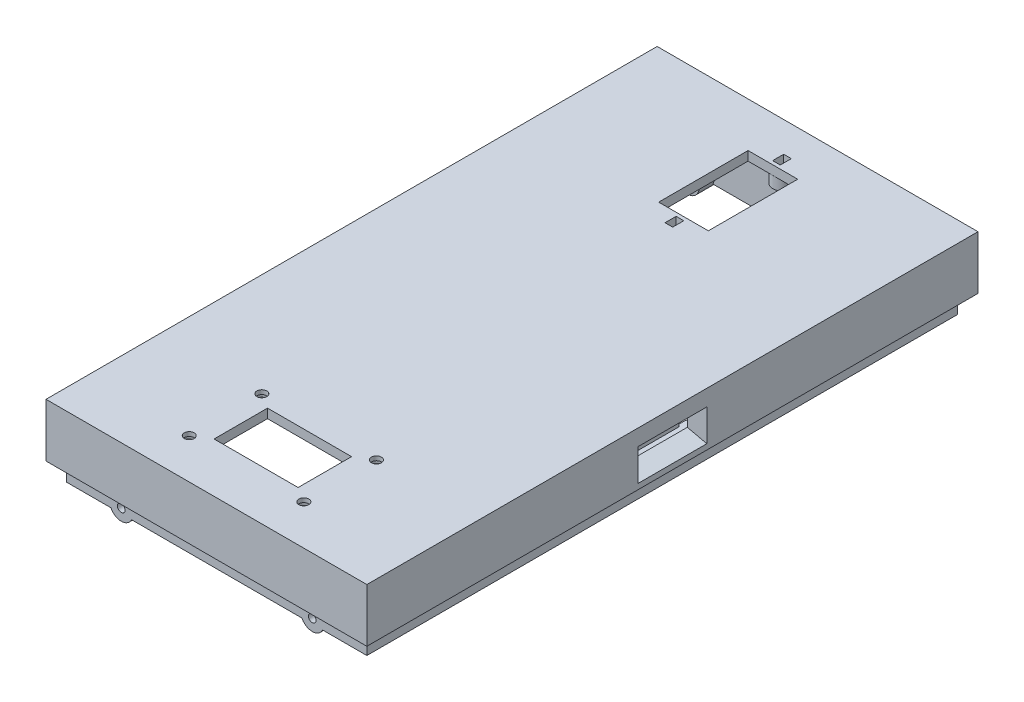
from build123d import *

# Parameters (mm, degrees)
BOSS_EXTRUDE1_START  = -80
SKETCH1_W            = 84
SKETCH1_H            = 14
BOSS_EXTRUDE1_DEPTH  = 160
BOSS_EXTRUDE2_START  = -77.3
SKETCH2_W            = 78.6
SKETCH2_H            = 5.3
BOSS_EXTRUDE2_DEPTH  = 154.6
BOSS_EXTRUDE3_START  = -74.9
SKETCH3_W            = 73.8
SKETCH3_H            = 17.4
BOSS_EXTRUDE3_DEPTH  = 149.8
BOSS_EXTRUDE4_START  = -77.3
SKETCH4_R            = 3
BOSS_EXTRUDE4_DEPTH  = 6.3
BOSS_EXTRUDE5_START  = -78
SKETCH5_R            = 1
BOSS_EXTRUDE5_DEPTH  = 8
BOSS_EXTRUDE6_START  = -77.3
SKETCH6_R            = 3
BOSS_EXTRUDE6_DEPTH  = 6.3
BOSS_EXTRUDE7_START  = -78
SKETCH7_R            = 1
BOSS_EXTRUDE7_DEPTH  = 8
BOSS_EXTRUDE8_START  = 71
SKETCH8_R            = 3
BOSS_EXTRUDE8_DEPTH  = 6.3
BOSS_EXTRUDE9_START  = 70
SKETCH9_R            = 1
BOSS_EXTRUDE9_DEPTH  = 8
BOSS_EXTRUDE10_START = 71
SKETCH10_R           = 3
BOSS_EXTRUDE10_DEPTH = 6.3
BOSS_EXTRUDE11_START = 70
SKETCH11_R           = 1
BOSS_EXTRUDE11_DEPTH = 8
BOSS_EXTRUDE12_START = 53
SKETCH12_W           = 22
SKETCH12_H           = 4.4
BOSS_EXTRUDE12_DEPTH = 14
BOSS_EXTRUDE13_START = 46.6
SKETCH13_R           = 1.3
BOSS_EXTRUDE13_DEPTH = 4.4
BOSS_EXTRUDE14_START = 47.1
SKETCH14_R           = 2.3
BOSS_EXTRUDE14_DEPTH = 1.8
BOSS_EXTRUDE15_START = 46.6
SKETCH15_R           = 1.3
BOSS_EXTRUDE15_DEPTH = 4.4
BOSS_EXTRUDE16_START = 47.1
SKETCH16_R           = 2.3
BOSS_EXTRUDE16_DEPTH = 1.8
BOSS_EXTRUDE17_START = 46.6
SKETCH17_R           = 1.3
BOSS_EXTRUDE17_DEPTH = 4.4
BOSS_EXTRUDE18_START = 47.1
SKETCH18_R           = 2.3
BOSS_EXTRUDE18_DEPTH = 1.8
BOSS_EXTRUDE19_START = 46.6
SKETCH19_R           = 1.3
BOSS_EXTRUDE19_DEPTH = 4.4
BOSS_EXTRUDE20_START = 47.1
SKETCH20_R           = 2.3
BOSS_EXTRUDE20_DEPTH = 1.8
BOSS_EXTRUDE21_START = -68.3
SKETCH21_W           = 13
SKETCH21_H           = 4.4
BOSS_EXTRUDE21_DEPTH = 23.4
BOSS_EXTRUDE22_START = 44.6
SKETCH22_R           = 2.4
BOSS_EXTRUDE22_DEPTH = 3
BOSS_EXTRUDE23_START = -72.125
SKETCH23_W           = 2
SKETCH23_H           = 7.4
BOSS_EXTRUDE23_DEPTH = 2.9
BOSS_EXTRUDE24_START = 44.6
SKETCH24_R           = 2.4
BOSS_EXTRUDE24_DEPTH = 3
BOSS_EXTRUDE25_START = -43.975
SKETCH25_W           = 2
SKETCH25_H           = 7.4
BOSS_EXTRUDE25_DEPTH = 2.9
BOSS_EXTRUDE26_START = -9
BOSS_EXTRUDE26_DEPTH = 18
BOSS_EXTRUDE27_START = -13.5
SKETCH27_W           = 4.8
SKETCH27_H           = 1.2
BOSS_EXTRUDE27_DEPTH = 27
BOSS_EXTRUDE28_START = -11
SKETCH28_W           = 1.2
SKETCH28_H           = 3.6
BOSS_EXTRUDE28_DEPTH = 22
BOSS_EXTRUDE29_START = 9
SKETCH29_W           = 1.2
SKETCH29_H           = 13.2
BOSS_EXTRUDE29_DEPTH = 2
BOSS_EXTRUDE30_START = -11
SKETCH30_W           = 1.2
SKETCH30_H           = 13.2
BOSS_EXTRUDE30_DEPTH = 2
BOSS_EXTRUDE31_START = -9
BOSS_EXTRUDE31_DEPTH = 18
BOSS_EXTRUDE32_START = -13.5
SKETCH32_W           = 4.8
SKETCH32_H           = 1.2
BOSS_EXTRUDE32_DEPTH = 27
BOSS_EXTRUDE33_START = -11
SKETCH33_W           = 1.2
SKETCH33_H           = 3.6
BOSS_EXTRUDE33_DEPTH = 22
BOSS_EXTRUDE34_START = 9
SKETCH34_W           = 1.2
SKETCH34_H           = 13.2
BOSS_EXTRUDE34_DEPTH = 2
BOSS_EXTRUDE35_START = -11
SKETCH35_W           = 1.2
SKETCH35_H           = 13.2
BOSS_EXTRUDE35_DEPTH = 2
BOSS_EXTRUDE36_START = 3.6
SKETCH36_W           = 1.2
SKETCH36_H           = 1.2
BOSS_EXTRUDE36_DEPTH = 22.4
BOSS_EXTRUDE37_START = 3.6
SKETCH37_W           = 1.2
SKETCH37_H           = 2.5
BOSS_EXTRUDE37_DEPTH = 22.4
BOSS_EXTRUDE38_START = 2.4
SKETCH38_W           = 19.6
SKETCH38_H           = 2.5
BOSS_EXTRUDE38_DEPTH = 1.2
BOSS_EXTRUDE39_START = 26
SKETCH39_W           = 19.6
SKETCH39_H           = 2.5
BOSS_EXTRUDE39_DEPTH = 1.2
BOSS_EXTRUDE40_START = 16.5
SKETCH40_W           = 1.2
SKETCH40_H           = 2.5
BOSS_EXTRUDE40_DEPTH = 30.5
BOSS_EXTRUDE41_START = 15.3
SKETCH41_W           = 16.5
SKETCH41_H           = 2.5
BOSS_EXTRUDE41_DEPTH = 1.2
BOSS_EXTRUDE42_START = -37.5
SKETCH42_W           = 1.2
SKETCH42_H           = 2.5
BOSS_EXTRUDE42_DEPTH = 36
BOSS_EXTRUDE43_START = -37.5
SKETCH43_W           = 1.2
SKETCH43_H           = 2.5
BOSS_EXTRUDE43_DEPTH = 36
BOSS_EXTRUDE44_START = -38.7
SKETCH44_W           = 52.8
SKETCH44_H           = 2.5
BOSS_EXTRUDE44_DEPTH = 1.2
BOSS_EXTRUDE45_START = -1.5
SKETCH45_W           = 52.8
SKETCH45_H           = 2.5
BOSS_EXTRUDE45_DEPTH = 1.2
BOSS_EXTRUDE46_START = -31.5
SKETCH46_W           = 4
SKETCH46_H           = 5
BOSS_EXTRUDE46_DEPTH = 3
BOSS_EXTRUDE47_START = -32
SKETCH47_W           = 2
SKETCH47_H           = 3.51
BOSS_EXTRUDE47_DEPTH = 4
BOSS_EXTRUDE48_START = -11.5
SKETCH48_W           = 4
SKETCH48_H           = 5
BOSS_EXTRUDE48_DEPTH = 3
BOSS_EXTRUDE49_START = -12
SKETCH49_W           = 2
SKETCH49_H           = 3.51
BOSS_EXTRUDE49_DEPTH = 4
BOSS_EXTRUDE50_START = -31.5
SKETCH50_W           = 4
SKETCH50_H           = 5
BOSS_EXTRUDE50_DEPTH = 3
BOSS_EXTRUDE51_START = -32
SKETCH51_W           = 2
SKETCH51_H           = 3.51
BOSS_EXTRUDE51_DEPTH = 4
BOSS_EXTRUDE52_START = -11.5
SKETCH52_W           = 4
SKETCH52_H           = 5
BOSS_EXTRUDE52_DEPTH = 3
BOSS_EXTRUDE53_START = -12
SKETCH53_W           = 2
SKETCH53_H           = 3.51
BOSS_EXTRUDE53_DEPTH = 4
BOSS_EXTRUDE54_START = 44.6
SKETCH54_R           = 2.8
BOSS_EXTRUDE54_DEPTH = 3
BOSS_EXTRUDE55_START = 44.1
SKETCH55_R           = 1
BOSS_EXTRUDE55_DEPTH = 5.1
BOSS_EXTRUDE56_START = 44.6
SKETCH56_R           = 2.8
BOSS_EXTRUDE56_DEPTH = 3
BOSS_EXTRUDE57_START = 44.1
SKETCH57_R           = 1
BOSS_EXTRUDE57_DEPTH = 5.1
BOSS_EXTRUDE58_START = 44.6
SKETCH58_R           = 2.8
BOSS_EXTRUDE58_DEPTH = 3
BOSS_EXTRUDE59_START = 44.1
SKETCH59_R           = 1
BOSS_EXTRUDE59_DEPTH = 5.1
BOSS_EXTRUDE60_START = 44.6
SKETCH60_R           = 2.8
BOSS_EXTRUDE60_DEPTH = 3
BOSS_EXTRUDE61_START = 44.1
SKETCH61_R           = 1
BOSS_EXTRUDE61_DEPTH = 5.1


with BuildPart() as part:
    # Sketch1 → Boss-Extrude1 (new body)
    with BuildSketch(Plane.XY.offset(BOSS_EXTRUDE1_START)):
        with Locations((0, 43)):
            Rectangle(SKETCH1_W, SKETCH1_H)
    extrude(amount=BOSS_EXTRUDE1_DEPTH)

    # Sketch2 → Boss-Extrude2 (add)
    with BuildSketch(Plane.XY.offset(BOSS_EXTRUDE2_START)):
        with Locations((0, 33.85)):
            Rectangle(SKETCH2_W, SKETCH2_H)
    extrude(amount=BOSS_EXTRUDE2_DEPTH)


with BuildPart() as body_2:
    # Sketch3 → Boss-Extrude3 (new body)
    with BuildSketch(Plane.XY.offset(BOSS_EXTRUDE3_START)):
        with Locations((0, 38.9)):
            Rectangle(SKETCH3_W, SKETCH3_H)
    extrude(amount=BOSS_EXTRUDE3_DEPTH)


with BuildPart() as part_1:
    add(part.part)

    # Combine1: cut body 2
    add(body_2.part, mode=Mode.SUBTRACT)

    # Sketch4 → Boss-Extrude4 (add)
    with BuildSketch(Plane.XY.offset(BOSS_EXTRUDE4_START)):
        with Locations((-25, 32.5)):
            Circle(SKETCH4_R)
    extrude(amount=BOSS_EXTRUDE4_DEPTH)


with BuildPart() as body_2_2:
    # Sketch5 → Boss-Extrude5 (new body)
    with BuildSketch(Plane.XY.offset(BOSS_EXTRUDE5_START)):
        with Locations((-25, 32.5)):
            Circle(SKETCH5_R)
    extrude(amount=BOSS_EXTRUDE5_DEPTH)


with BuildPart() as part_2:
    add(part_1.part)

    # Combine2: cut body 2 2
    add(body_2_2.part, mode=Mode.SUBTRACT)

    # Sketch6 → Boss-Extrude6 (add)
    with BuildSketch(Plane.XY.offset(BOSS_EXTRUDE6_START)):
        with Locations((25, 32.5)):
            Circle(SKETCH6_R)
    extrude(amount=BOSS_EXTRUDE6_DEPTH)


with BuildPart() as body_2_3:
    # Sketch7 → Boss-Extrude7 (new body)
    with BuildSketch(Plane.XY.offset(BOSS_EXTRUDE7_START)):
        with Locations((25, 32.5)):
            Circle(SKETCH7_R)
    extrude(amount=BOSS_EXTRUDE7_DEPTH)


with BuildPart() as part_3:
    add(part_2.part)

    # Combine3: cut body 2 3
    add(body_2_3.part, mode=Mode.SUBTRACT)

    # Sketch8 → Boss-Extrude8 (add)
    with BuildSketch(Plane.XY.offset(BOSS_EXTRUDE8_START)):
        with Locations((-25, 32.5)):
            Circle(SKETCH8_R)
    extrude(amount=BOSS_EXTRUDE8_DEPTH)


with BuildPart() as body_2_4:
    # Sketch9 → Boss-Extrude9 (new body)
    with BuildSketch(Plane.XY.offset(BOSS_EXTRUDE9_START)):
        with Locations((-25, 32.5)):
            Circle(SKETCH9_R)
    extrude(amount=BOSS_EXTRUDE9_DEPTH)


with BuildPart() as part_4:
    add(part_3.part)

    # Combine4: cut body 2 4
    add(body_2_4.part, mode=Mode.SUBTRACT)

    # Sketch10 → Boss-Extrude10 (add)
    with BuildSketch(Plane.XY.offset(BOSS_EXTRUDE10_START)):
        with Locations((25, 32.5)):
            Circle(SKETCH10_R)
    extrude(amount=BOSS_EXTRUDE10_DEPTH)


with BuildPart() as body_2_5:
    # Sketch11 → Boss-Extrude11 (new body)
    with BuildSketch(Plane.XY.offset(BOSS_EXTRUDE11_START)):
        with Locations((25, 32.5)):
            Circle(SKETCH11_R)
    extrude(amount=BOSS_EXTRUDE11_DEPTH)


with BuildPart() as part_5:
    add(part_4.part)

    # Combine5: cut body 2 5
    add(body_2_5.part, mode=Mode.SUBTRACT)


with BuildPart() as body_2_6:
    # Sketch12 → Boss-Extrude12 (new body)
    with BuildSketch(Plane.XY.offset(BOSS_EXTRUDE12_START)):
        with Locations((0, 48.8)):
            Rectangle(SKETCH12_W, SKETCH12_H)
    extrude(amount=BOSS_EXTRUDE12_DEPTH)


with BuildPart() as part_6:
    add(part_5.part)

    # Combine6: cut body 2 6
    add(body_2_6.part, mode=Mode.SUBTRACT)


with BuildPart() as body_2_7:
    # Sketch13 → Boss-Extrude13 (new body)
    with BuildSketch(Plane(origin=(0, 0, 0), x_dir=(1, 0, 0), z_dir=(0, 1, 0)).offset(BOSS_EXTRUDE13_START)):
        with Locations((-15, -50.5)):
            Circle(SKETCH13_R)
    extrude(amount=BOSS_EXTRUDE13_DEPTH)


with BuildPart() as part_7:
    add(part_6.part)

    # Combine7: cut body 2 7
    add(body_2_7.part, mode=Mode.SUBTRACT)


with BuildPart() as body_2_8:
    # Sketch14 → Boss-Extrude14 (new body)
    with BuildSketch(Plane(origin=(0, 0, 0), x_dir=(1, 0, 0), z_dir=(0, 1, 0)).offset(BOSS_EXTRUDE14_START)):
        with Locations((-15, -50.5)):
            Circle(SKETCH14_R)
    extrude(amount=BOSS_EXTRUDE14_DEPTH)


with BuildPart() as part_8:
    add(part_7.part)

    # Combine8: cut body 2 8
    add(body_2_8.part, mode=Mode.SUBTRACT)


with BuildPart() as body_2_9:
    # Sketch15 → Boss-Extrude15 (new body)
    with BuildSketch(Plane(origin=(0, 0, 0), x_dir=(1, 0, 0), z_dir=(0, 1, 0)).offset(BOSS_EXTRUDE15_START)):
        with Locations((-15, -69.5)):
            Circle(SKETCH15_R)
    extrude(amount=BOSS_EXTRUDE15_DEPTH)


with BuildPart() as part_9:
    add(part_8.part)

    # Combine9: cut body 2 9
    add(body_2_9.part, mode=Mode.SUBTRACT)


with BuildPart() as body_2_10:
    # Sketch16 → Boss-Extrude16 (new body)
    with BuildSketch(Plane(origin=(0, 0, 0), x_dir=(1, 0, 0), z_dir=(0, 1, 0)).offset(BOSS_EXTRUDE16_START)):
        with Locations((-15, -69.5)):
            Circle(SKETCH16_R)
    extrude(amount=BOSS_EXTRUDE16_DEPTH)


with BuildPart() as part_10:
    add(part_9.part)

    # Combine10: cut body 2 10
    add(body_2_10.part, mode=Mode.SUBTRACT)


with BuildPart() as body_2_11:
    # Sketch17 → Boss-Extrude17 (new body)
    with BuildSketch(Plane(origin=(0, 0, 0), x_dir=(1, 0, 0), z_dir=(0, 1, 0)).offset(BOSS_EXTRUDE17_START)):
        with Locations((15, -50.5)):
            Circle(SKETCH17_R)
    extrude(amount=BOSS_EXTRUDE17_DEPTH)


with BuildPart() as part_11:
    add(part_10.part)

    # Combine11: cut body 2 11
    add(body_2_11.part, mode=Mode.SUBTRACT)


with BuildPart() as body_2_12:
    # Sketch18 → Boss-Extrude18 (new body)
    with BuildSketch(Plane(origin=(0, 0, 0), x_dir=(1, 0, 0), z_dir=(0, 1, 0)).offset(BOSS_EXTRUDE18_START)):
        with Locations((15, -50.5)):
            Circle(SKETCH18_R)
    extrude(amount=BOSS_EXTRUDE18_DEPTH)


with BuildPart() as part_12:
    add(part_11.part)

    # Combine12: cut body 2 12
    add(body_2_12.part, mode=Mode.SUBTRACT)


with BuildPart() as body_2_13:
    # Sketch19 → Boss-Extrude19 (new body)
    with BuildSketch(Plane(origin=(0, 0, 0), x_dir=(1, 0, 0), z_dir=(0, 1, 0)).offset(BOSS_EXTRUDE19_START)):
        with Locations((15, -69.5)):
            Circle(SKETCH19_R)
    extrude(amount=BOSS_EXTRUDE19_DEPTH)


with BuildPart() as part_13:
    add(part_12.part)

    # Combine13: cut body 2 13
    add(body_2_13.part, mode=Mode.SUBTRACT)


with BuildPart() as body_2_14:
    # Sketch20 → Boss-Extrude20 (new body)
    with BuildSketch(Plane(origin=(0, 0, 0), x_dir=(1, 0, 0), z_dir=(0, 1, 0)).offset(BOSS_EXTRUDE20_START)):
        with Locations((15, -69.5)):
            Circle(SKETCH20_R)
    extrude(amount=BOSS_EXTRUDE20_DEPTH)


with BuildPart() as part_14:
    add(part_13.part)

    # Combine14: cut body 2 14
    add(body_2_14.part, mode=Mode.SUBTRACT)


with BuildPart() as body_2_15:
    # Sketch21 → Boss-Extrude21 (new body)
    with BuildSketch(Plane.XY.offset(BOSS_EXTRUDE21_START)):
        with Locations((0, 48.8)):
            Rectangle(SKETCH21_W, SKETCH21_H)
    extrude(amount=BOSS_EXTRUDE21_DEPTH)


with BuildPart() as part_15:
    add(part_14.part)

    # Combine15: cut body 2 15
    add(body_2_15.part, mode=Mode.SUBTRACT)

    # Sketch22 → Boss-Extrude22 (add)
    with BuildSketch(Plane(origin=(0, 0, 0), x_dir=(1, 0, 0), z_dir=(0, 1, 0)).offset(BOSS_EXTRUDE22_START)):
        with Locations((0, 70.675)):
            Circle(SKETCH22_R)
    extrude(amount=BOSS_EXTRUDE22_DEPTH)


with BuildPart() as body_2_16:
    # Sketch23 → Boss-Extrude23 (new body)
    with BuildSketch(Plane.XY.offset(BOSS_EXTRUDE23_START)):
        with Locations((0, 47.3)):
            Rectangle(SKETCH23_W, SKETCH23_H)
    extrude(amount=BOSS_EXTRUDE23_DEPTH)


with BuildPart() as part_16:
    add(part_15.part)

    # Combine16: cut body 2 16
    add(body_2_16.part, mode=Mode.SUBTRACT)

    # Sketch24 → Boss-Extrude24 (add)
    with BuildSketch(Plane(origin=(0, 0, 0), x_dir=(1, 0, 0), z_dir=(0, 1, 0)).offset(BOSS_EXTRUDE24_START)):
        with Locations((0, 42.525)):
            Circle(SKETCH24_R)
    extrude(amount=BOSS_EXTRUDE24_DEPTH)


with BuildPart() as body_2_17:
    # Sketch25 → Boss-Extrude25 (new body)
    with BuildSketch(Plane.XY.offset(BOSS_EXTRUDE25_START)):
        with Locations((0, 47.3)):
            Rectangle(SKETCH25_W, SKETCH25_H)
    extrude(amount=BOSS_EXTRUDE25_DEPTH)


with BuildPart() as part_17:
    add(part_16.part)

    # Combine17: cut body 2 17
    add(body_2_17.part, mode=Mode.SUBTRACT)


with BuildPart() as body_2_18:
    # Sketch26 → Boss-Extrude26 (new body)
    with BuildSketch(Plane.XY.offset(BOSS_EXTRUDE26_START)):
        Polygon((-36, 38.6), (-36.9, 38.6), (-43, 37.2), (-43, 46), (-36.9, 44.6), (-36, 44.6), align=None)
    extrude(amount=BOSS_EXTRUDE26_DEPTH)


with BuildPart() as part_18:
    add(part_17.part)

    # Combine18: cut body 2 18
    add(body_2_18.part, mode=Mode.SUBTRACT)

    # Sketch27 → Boss-Extrude27 (add)
    with BuildSketch(Plane.XY.offset(BOSS_EXTRUDE27_START)):
        with Locations((-34.5, 35)):
            Rectangle(SKETCH27_W, SKETCH27_H)
    extrude(amount=BOSS_EXTRUDE27_DEPTH)

    # Sketch28 → Boss-Extrude28 (add)
    with BuildSketch(Plane.XY.offset(BOSS_EXTRUDE28_START)):
        with Locations((-32.1, 36.2)):
            Rectangle(SKETCH28_W, SKETCH28_H)
    extrude(amount=BOSS_EXTRUDE28_DEPTH)

    # Sketch29 → Boss-Extrude29 (add)
    with BuildSketch(Plane.XY.offset(BOSS_EXTRUDE29_START)):
        with Locations((-32.1, 41)):
            Rectangle(SKETCH29_W, SKETCH29_H)
    extrude(amount=BOSS_EXTRUDE29_DEPTH)

    # Sketch30 → Boss-Extrude30 (add)
    with BuildSketch(Plane.XY.offset(BOSS_EXTRUDE30_START)):
        with Locations((-32.1, 41)):
            Rectangle(SKETCH30_W, SKETCH30_H)
    extrude(amount=BOSS_EXTRUDE30_DEPTH)


with BuildPart() as body_2_19:
    # Sketch31 → Boss-Extrude31 (new body)
    with BuildSketch(Plane.XY.offset(BOSS_EXTRUDE31_START)):
        Polygon((36, 38.6), (36.9, 38.6), (43, 37.2), (43, 46), (36.9, 44.6), (36, 44.6), align=None)
    extrude(amount=BOSS_EXTRUDE31_DEPTH)


with BuildPart() as part_19:
    add(part_18.part)

    # Combine19: cut body 2 19
    add(body_2_19.part, mode=Mode.SUBTRACT)

    # Sketch32 → Boss-Extrude32 (add)
    with BuildSketch(Plane.XY.offset(BOSS_EXTRUDE32_START)):
        with Locations((34.5, 35)):
            Rectangle(SKETCH32_W, SKETCH32_H)
    extrude(amount=BOSS_EXTRUDE32_DEPTH)

    # Sketch33 → Boss-Extrude33 (add)
    with BuildSketch(Plane.XY.offset(BOSS_EXTRUDE33_START)):
        with Locations((32.1, 36.2)):
            Rectangle(SKETCH33_W, SKETCH33_H)
    extrude(amount=BOSS_EXTRUDE33_DEPTH)

    # Sketch34 → Boss-Extrude34 (add)
    with BuildSketch(Plane.XY.offset(BOSS_EXTRUDE34_START)):
        with Locations((32.1, 41)):
            Rectangle(SKETCH34_W, SKETCH34_H)
    extrude(amount=BOSS_EXTRUDE34_DEPTH)

    # Sketch35 → Boss-Extrude35 (add)
    with BuildSketch(Plane.XY.offset(BOSS_EXTRUDE35_START)):
        with Locations((32.1, 41)):
            Rectangle(SKETCH35_W, SKETCH35_H)
    extrude(amount=BOSS_EXTRUDE35_DEPTH)

    # Sketch37 → Boss-Extrude37 (add)
    with BuildSketch(Plane.XY.offset(BOSS_EXTRUDE37_START)):
        with Locations((9.2, 46.35)):
            Rectangle(SKETCH37_W, SKETCH37_H)
    extrude(amount=BOSS_EXTRUDE37_DEPTH)



with BuildPart() as body_2_20:
    # Sketch36 → Boss-Extrude36 (new body)
    with BuildSketch(Plane.XY.offset(BOSS_EXTRUDE36_START)):
        with Locations((-9.2, 45.7)):
            Rectangle(SKETCH36_W, SKETCH36_H)
    extrude(amount=BOSS_EXTRUDE36_DEPTH)


with BuildPart() as part_20:
    add(part_19.part)

    add(body_2_20.part)  # Boss-Extrude38 merges body 2 20
    # Sketch38 → Boss-Extrude38 (add)
    with BuildSketch(Plane.XY.offset(BOSS_EXTRUDE38_START)):
        with Locations((0, 46.35)):
            Rectangle(SKETCH38_W, SKETCH38_H)
    extrude(amount=BOSS_EXTRUDE38_DEPTH)

    # Sketch39 → Boss-Extrude39 (add)
    with BuildSketch(Plane.XY.offset(BOSS_EXTRUDE39_START)):
        with Locations((0, 46.35)):
            Rectangle(SKETCH39_W, SKETCH39_H)
    extrude(amount=BOSS_EXTRUDE39_DEPTH)

    # Sketch40 → Boss-Extrude40 (add)
    with BuildSketch(Plane.XY.offset(BOSS_EXTRUDE40_START)):
        with Locations((15.5, 46.35)):
            Rectangle(SKETCH40_W, SKETCH40_H)
    extrude(amount=BOSS_EXTRUDE40_DEPTH)

    # Sketch41 → Boss-Extrude41 (add)
    with BuildSketch(Plane.XY.offset(BOSS_EXTRUDE41_START)):
        with Locations((23.15, 46.35)):
            Rectangle(SKETCH41_W, SKETCH41_H)
    extrude(amount=BOSS_EXTRUDE41_DEPTH)

    # Sketch42 → Boss-Extrude42 (add)
    with BuildSketch(Plane.XY.offset(BOSS_EXTRUDE42_START)):
        with Locations((-25.8, 46.35)):
            Rectangle(SKETCH42_W, SKETCH42_H)
    extrude(amount=BOSS_EXTRUDE42_DEPTH)

    # Sketch43 → Boss-Extrude43 (add)
    with BuildSketch(Plane.XY.offset(BOSS_EXTRUDE43_START)):
        with Locations((25.8, 46.35)):
            Rectangle(SKETCH43_W, SKETCH43_H)
    extrude(amount=BOSS_EXTRUDE43_DEPTH)

    # Sketch44 → Boss-Extrude44 (add)
    with BuildSketch(Plane.XY.offset(BOSS_EXTRUDE44_START)):
        with Locations((0, 46.35)):
            Rectangle(SKETCH44_W, SKETCH44_H)
    extrude(amount=BOSS_EXTRUDE44_DEPTH)

    # Sketch45 → Boss-Extrude45 (add)
    with BuildSketch(Plane.XY.offset(BOSS_EXTRUDE45_START)):
        with Locations((0, 46.35)):
            Rectangle(SKETCH45_W, SKETCH45_H)
    extrude(amount=BOSS_EXTRUDE45_DEPTH)

    # Sketch46 → Boss-Extrude46 (add)
    with BuildSketch(Plane.XY.offset(BOSS_EXTRUDE46_START)):
        with Locations((-29.4, 45.1)):
            Rectangle(SKETCH46_W, SKETCH46_H)
    extrude(amount=BOSS_EXTRUDE46_DEPTH)


with BuildPart() as body_2_21:
    # Sketch47 → Boss-Extrude47 (new body)
    with BuildSketch(Plane.XY.offset(BOSS_EXTRUDE47_START)):
        with Locations((-29.4, 45.855)):
            Rectangle(SKETCH47_W, SKETCH47_H)
    extrude(amount=BOSS_EXTRUDE47_DEPTH)


with BuildPart() as part_21:
    add(part_20.part)

    # Combine20: cut body 2 21
    add(body_2_21.part, mode=Mode.SUBTRACT)

    # Sketch48 → Boss-Extrude48 (add)
    with BuildSketch(Plane.XY.offset(BOSS_EXTRUDE48_START)):
        with Locations((-29.4, 45.1)):
            Rectangle(SKETCH48_W, SKETCH48_H)
    extrude(amount=BOSS_EXTRUDE48_DEPTH)


with BuildPart() as body_2_22:
    # Sketch49 → Boss-Extrude49 (new body)
    with BuildSketch(Plane.XY.offset(BOSS_EXTRUDE49_START)):
        with Locations((-29.4, 45.855)):
            Rectangle(SKETCH49_W, SKETCH49_H)
    extrude(amount=BOSS_EXTRUDE49_DEPTH)


with BuildPart() as part_22:
    add(part_21.part)

    # Combine21: cut body 2 22
    add(body_2_22.part, mode=Mode.SUBTRACT)

    # Sketch50 → Boss-Extrude50 (add)
    with BuildSketch(Plane.XY.offset(BOSS_EXTRUDE50_START)):
        with Locations((29.4, 45.1)):
            Rectangle(SKETCH50_W, SKETCH50_H)
    extrude(amount=BOSS_EXTRUDE50_DEPTH)


with BuildPart() as body_2_23:
    # Sketch51 → Boss-Extrude51 (new body)
    with BuildSketch(Plane.XY.offset(BOSS_EXTRUDE51_START)):
        with Locations((29.4, 45.855)):
            Rectangle(SKETCH51_W, SKETCH51_H)
    extrude(amount=BOSS_EXTRUDE51_DEPTH)


with BuildPart() as part_23:
    add(part_22.part)

    # Combine22: cut body 2 23
    add(body_2_23.part, mode=Mode.SUBTRACT)

    # Sketch52 → Boss-Extrude52 (add)
    with BuildSketch(Plane.XY.offset(BOSS_EXTRUDE52_START)):
        with Locations((29.4, 45.1)):
            Rectangle(SKETCH52_W, SKETCH52_H)
    extrude(amount=BOSS_EXTRUDE52_DEPTH)


with BuildPart() as body_2_24:
    # Sketch53 → Boss-Extrude53 (new body)
    with BuildSketch(Plane.XY.offset(BOSS_EXTRUDE53_START)):
        with Locations((29.4, 45.855)):
            Rectangle(SKETCH53_W, SKETCH53_H)
    extrude(amount=BOSS_EXTRUDE53_DEPTH)


with BuildPart() as part_24:
    add(part_23.part)

    # Combine23: cut body 2 24
    add(body_2_24.part, mode=Mode.SUBTRACT)

    # Sketch54 → Boss-Extrude54 (add)
    with BuildSketch(Plane(origin=(0, 0, 0), x_dir=(1, 0, 0), z_dir=(0, 1, 0)).offset(BOSS_EXTRUDE54_START)):
        with Locations((-32, 25)):
            Circle(SKETCH54_R)
    extrude(amount=BOSS_EXTRUDE54_DEPTH)


with BuildPart() as body_2_25:
    # Sketch55 → Boss-Extrude55 (new body)
    with BuildSketch(Plane(origin=(0, 0, 0), x_dir=(1, 0, 0), z_dir=(0, 1, 0)).offset(BOSS_EXTRUDE55_START)):
        with Locations((-32, 25)):
            Circle(SKETCH55_R)
    extrude(amount=BOSS_EXTRUDE55_DEPTH)


with BuildPart() as part_25:
    add(part_24.part)

    # Combine24: cut body 2 25
    add(body_2_25.part, mode=Mode.SUBTRACT)

    # Sketch56 → Boss-Extrude56 (add)
    with BuildSketch(Plane(origin=(0, 0, 0), x_dir=(1, 0, 0), z_dir=(0, 1, 0)).offset(BOSS_EXTRUDE56_START)):
        with Locations((32, 25)):
            Circle(SKETCH56_R)
    extrude(amount=BOSS_EXTRUDE56_DEPTH)


with BuildPart() as body_2_26:
    # Sketch57 → Boss-Extrude57 (new body)
    with BuildSketch(Plane(origin=(0, 0, 0), x_dir=(1, 0, 0), z_dir=(0, 1, 0)).offset(BOSS_EXTRUDE57_START)):
        with Locations((32, 25)):
            Circle(SKETCH57_R)
    extrude(amount=BOSS_EXTRUDE57_DEPTH)


with BuildPart() as part_26:
    add(part_25.part)

    # Combine25: cut body 2 26
    add(body_2_26.part, mode=Mode.SUBTRACT)

    # Sketch58 → Boss-Extrude58 (add)
    with BuildSketch(Plane(origin=(0, 0, 0), x_dir=(1, 0, 0), z_dir=(0, 1, 0)).offset(BOSS_EXTRUDE58_START)):
        with Locations((-21, 60)):
            Circle(SKETCH58_R)
    extrude(amount=BOSS_EXTRUDE58_DEPTH)


with BuildPart() as body_2_27:
    # Sketch59 → Boss-Extrude59 (new body)
    with BuildSketch(Plane(origin=(0, 0, 0), x_dir=(1, 0, 0), z_dir=(0, 1, 0)).offset(BOSS_EXTRUDE59_START)):
        with Locations((-21, 60)):
            Circle(SKETCH59_R)
    extrude(amount=BOSS_EXTRUDE59_DEPTH)


with BuildPart() as part_27:
    add(part_26.part)

    # Combine26: cut body 2 27
    add(body_2_27.part, mode=Mode.SUBTRACT)

    # Sketch60 → Boss-Extrude60 (add)
    with BuildSketch(Plane(origin=(0, 0, 0), x_dir=(1, 0, 0), z_dir=(0, 1, 0)).offset(BOSS_EXTRUDE60_START)):
        with Locations((21, 60)):
            Circle(SKETCH60_R)
    extrude(amount=BOSS_EXTRUDE60_DEPTH)


with BuildPart() as body_2_28:
    # Sketch61 → Boss-Extrude61 (new body)
    with BuildSketch(Plane(origin=(0, 0, 0), x_dir=(1, 0, 0), z_dir=(0, 1, 0)).offset(BOSS_EXTRUDE61_START)):
        with Locations((21, 60)):
            Circle(SKETCH61_R)
    extrude(amount=BOSS_EXTRUDE61_DEPTH)


with BuildPart() as part_28:
    add(part_27.part)

    # Combine27: cut body 2 28
    add(body_2_28.part, mode=Mode.SUBTRACT)


solid = part_28.part
